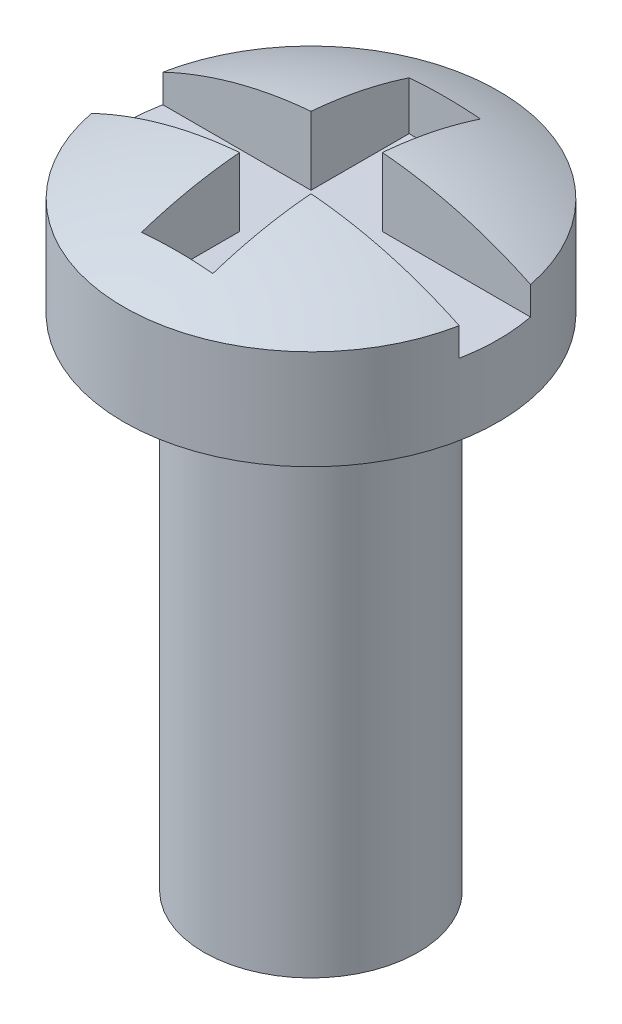
from build123d import *

# Parameters (mm, degrees)
SKETCH_1_R          = 1.5
EXTRUDE_1_DEPTH     = 7
SKETCH_2_R          = 2.625
EXTRUDE_2_DEPTH     = 2
SKETCH_3_W          = 7.004697232
SKETCH_3_H          = 1
CUT_EXTRUDE_1_DEPTH = 1
SKETCH_4_W          = 1
SKETCH_4_H          = 3.75
CUT_EXTRUDE_2_DEPTH = 1


with BuildPart() as part:
    # 草图1 → 拉伸1 (new body)
    with BuildSketch(Plane(origin=(0, 0, 0), x_dir=(1, 0, 0), z_dir=(0, 1, 0))):
        Circle(SKETCH_1_R)
    extrude(amount=EXTRUDE_1_DEPTH)

    # 草图2 → 拉伸2 (add)
    with BuildSketch(Plane(origin=(0, 7, 0), x_dir=(-1, 0, 0), z_dir=(0, 1, 0))):
        Circle(SKETCH_2_R)
    extrude(amount=EXTRUDE_2_DEPTH)

    # 草图3 → 切除-拉伸1 (cut)
    with BuildSketch(Plane(origin=(0, 9, 0), x_dir=(-1, 0, 0), z_dir=(0, 1, 0))):
        Rectangle(SKETCH_3_W, SKETCH_3_H)
    extrude(amount=-CUT_EXTRUDE_1_DEPTH, mode=Mode.SUBTRACT)

    # 草图4 → 切除-拉伸2 (cut)
    with BuildSketch(Plane(origin=(0, 9, 0), x_dir=(-1, 0, 0), z_dir=(0, 1, 0))):
        Rectangle(SKETCH_4_W, SKETCH_4_H)
    extrude(amount=-CUT_EXTRUDE_2_DEPTH, mode=Mode.SUBTRACT)

    # 草图5 → 切除-旋转16 (revolve, cut)
    with BuildSketch(Plane(origin=(0, 0, 0), x_dir=(0, 0, -1), z_dir=(1, 0, 0))):
        with BuildLine():
            Line((0, 10.999822694), (-4.5493707, 10.999822694))
            Line((-4.5493707, 10.999822694), (-4.5493707, 6.911933822))
            ThreePointArc((-4.5493707, 6.911933822), (-2.502838096, 8.453054325), (0, 9))
            Line((0, 9), (0, 10.999822694))
        make_face()
    revolve(axis=Axis((0, -2.105917543, 0), (0, 1, 0)), mode=Mode.SUBTRACT)


solid = part.part
